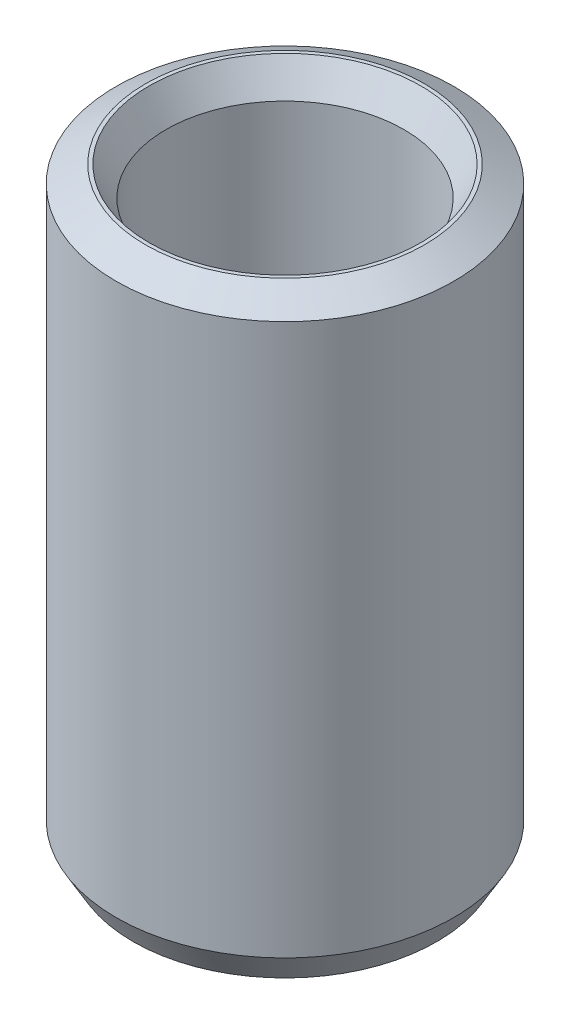
from build123d import *
from OCP.BRepFilletAPI import BRepFilletAPI_MakeChamfer

# Parameters (mm, degrees)
SKETCH1_R           = 15
BOSS_EXTRUDE1_DEPTH = 53.062877447
SKETCH2_R           = 10.56716789
CUT_EXTRUDE1_DEPTH  = 58.146031909
CHAMFER1_SIZE       = 1.503725058
CHAMFER1_SIZE2      = 2.604528202


with BuildPart() as part:
    # Sketch1 → Boss-Extrude1 (new body)
    with BuildSketch(Plane(origin=(0, 0, 0), x_dir=(1, 0, 0), z_dir=(0, 1, 0))):
        Circle(SKETCH1_R)
    extrude(amount=BOSS_EXTRUDE1_DEPTH)

    # Sketch2 → Cut-Extrude1 (cut, through all)
    with BuildSketch(Plane(origin=(0, 0, 0), x_dir=(1, 0, 0), z_dir=(0, 1, 0))):
        Circle(SKETCH2_R)
    extrude(amount=CUT_EXTRUDE1_DEPTH, mode=Mode.SUBTRACT)

    # Chamfer1: one chamfer whose edges measure the first distance from different faces: ONE call of the kernel's chamfer builder (chamfer() names one face for all edges)
    chamfer1_edges_1 = [part.edges().sort_by_distance(p)[0] for p in [
        (-10.56716789, 53.062877447, 0),
    ]]
    chamfer1_side_1 = [part.faces().sort_by_distance(p)[0] for p in [
        (-14.575735931, 53.062877447, 0),
    ]]
    chamfer1_edges_2 = [part.edges().sort_by_distance(p)[0] for p in [
        (-10.56716789, 0, 0),
    ]]
    chamfer1_side_2 = [part.faces().sort_by_distance(p)[0] for p in [
        (-10.56716789, 26.531438724, 0),
    ]]
    chamfer1_edges_3 = [part.edges().sort_by_distance(p)[0] for p in [
        (-15, 0, 0),
    ]]
    chamfer1_side_3 = [part.faces().sort_by_distance(p)[0] for p in [
        (-14.575735931, 0, 0),
    ]]
    chamfer1_edges_4 = [part.edges().sort_by_distance(p)[0] for p in [
        (-15, 53.062877447, 0),
    ]]
    chamfer1_side_4 = [part.faces().sort_by_distance(p)[0] for p in [
        (-15, 26.531438724, 0),
    ]]
    chamfer1 = BRepFilletAPI_MakeChamfer(part.part.solid().wrapped)
    for e in chamfer1_edges_1:
        chamfer1.Add(CHAMFER1_SIZE, CHAMFER1_SIZE2, e.wrapped, chamfer1_side_1[0].wrapped)  # the first distance lies on this face
    for e in chamfer1_edges_2:
        chamfer1.Add(CHAMFER1_SIZE, CHAMFER1_SIZE2, e.wrapped, chamfer1_side_2[0].wrapped)  # the first distance lies on this face
    for e in chamfer1_edges_3:
        chamfer1.Add(CHAMFER1_SIZE, CHAMFER1_SIZE2, e.wrapped, chamfer1_side_3[0].wrapped)  # the first distance lies on this face
    for e in chamfer1_edges_4:
        chamfer1.Add(CHAMFER1_SIZE, CHAMFER1_SIZE2, e.wrapped, chamfer1_side_4[0].wrapped)  # the first distance lies on this face
    add(Compound.cast(chamfer1.Shape()), mode=Mode.REPLACE)


solid = part.part
